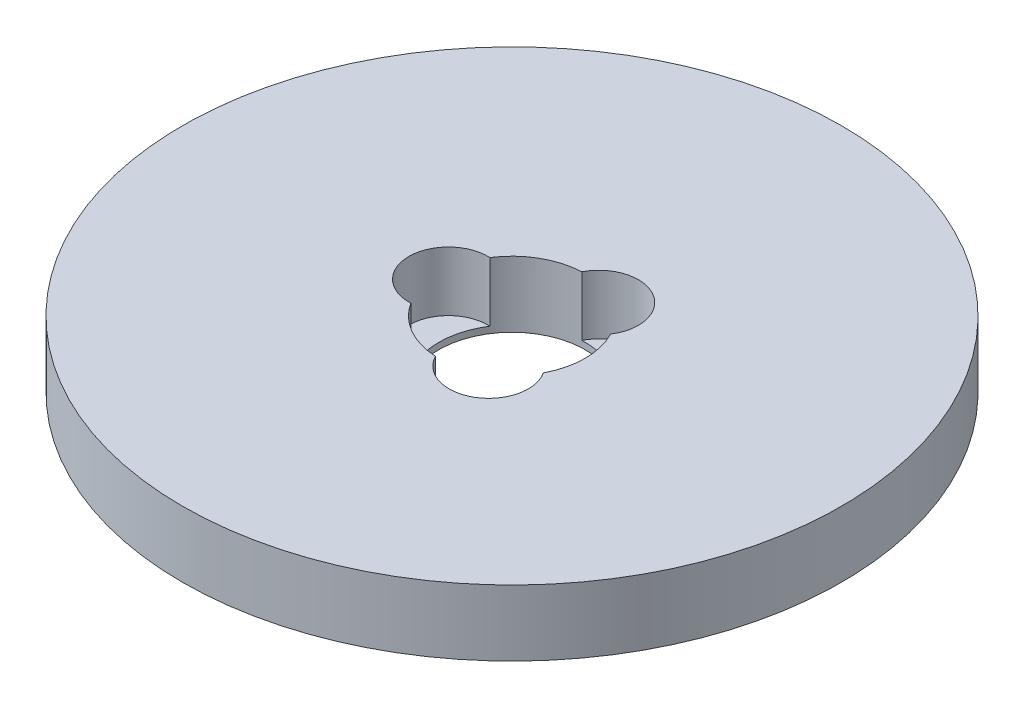
from build123d import *

# Parameters (mm, degrees)
SKETCH1_R           = 45
BOSS_EXTRUDE1_DEPTH = 9
SKETCH2_R           = 10
CUT_EXTRUDE1_DEPTH  = 65.272855857
SKETCH3_R           = 5.399950445
CUT_EXTRUDE2_DEPTH  = 8.116411505
CIRPATTERN1_COUNT   = 3


with BuildPart() as part:
    # Sketch1 → Boss-Extrude1 (new body)
    with BuildSketch(Plane(origin=(0, 0, 0), x_dir=(1, 0, 0), z_dir=(0, 1, 0))):
        Circle(SKETCH1_R)
    extrude(amount=BOSS_EXTRUDE1_DEPTH)

    # Sketch2 → Cut-Extrude1 (cut, through all)
    with BuildSketch(Plane(origin=(0, 0, 0), x_dir=(1, 0, 0), z_dir=(0, 1, 0))):
        Circle(SKETCH2_R)
    extrude(amount=CUT_EXTRUDE1_DEPTH, mode=Mode.SUBTRACT)

    # Sketch3 → Cut-Extrude2 (cut)
    with BuildSketch(Plane(origin=(0, 9, 0), x_dir=(1, 0, 0), z_dir=(0, 1, 0))):
        with Locations((-8.680412506, 0)):
            Circle(SKETCH3_R)
    cut_extrude2 = extrude(amount=-CUT_EXTRUDE2_DEPTH, mode=Mode.SUBTRACT)

    # CirPattern1: Cut-Extrude2 ×3 about axis
    cirpattern1_axis = Axis((0, 0, 0), (0, 1, 0))
    for i in range(1, CIRPATTERN1_COUNT):
        add(cut_extrude2.rotate(cirpattern1_axis, i * 360 / CIRPATTERN1_COUNT), mode=Mode.SUBTRACT)


solid = part.part
